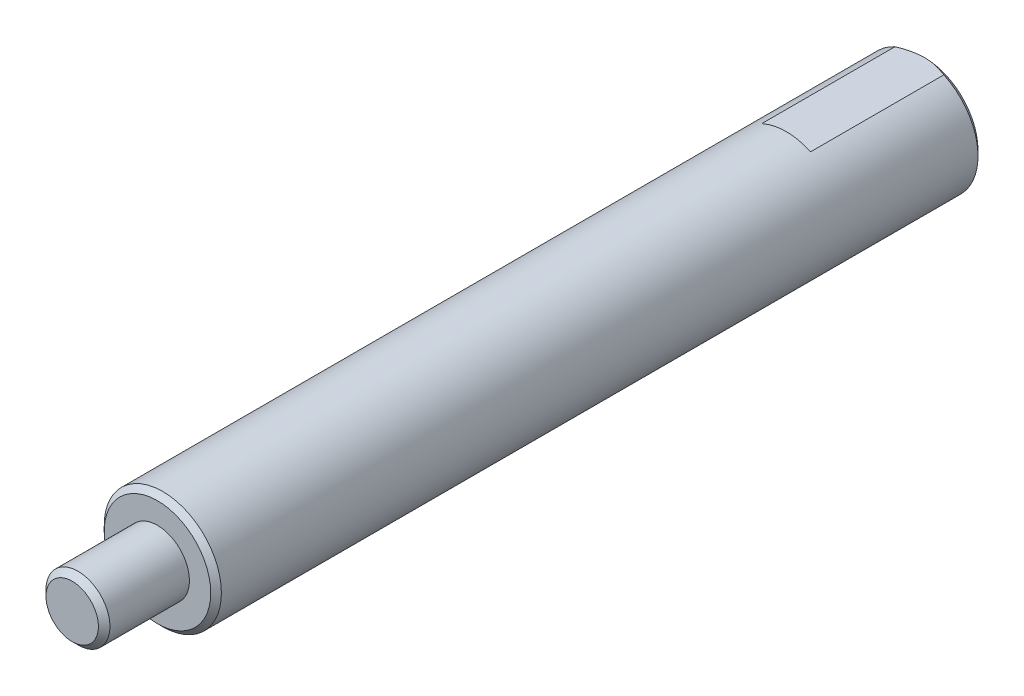
from build123d import *

# Parameters (mm, degrees)
SKETCH_1_R             = 5.5
EXTRUDE_1_DEPTH        = 72
CHAMFER_1_SIZE         = 0.5
SKETCH_2_R             = 3.3
EXTRUDE_2_DEPTH        = 8
HOLE_WIZARD_M5_1_D     = 4.2
HOLE_WIZARD_M5_1_DEPTH = 12.4
HOLE_WIZARD_M5_1_TIP   = 1.2618073
CHAMFER_3_SIZE         = 0.5
SKETCH_6_W             = 10
SKETCH_6_H             = 3
CUT_EXTRUDE_1_DEPTH    = 13


# Read off the part's stored shape, not the designer's step: M6 机械螺纹 螺柱1
with BuildPart() as part:
    # 草图1 → 拉伸1 (new body)
    with BuildSketch(Plane.XY):
        Circle(SKETCH_1_R)
    extrude(amount=EXTRUDE_1_DEPTH)

    # 倒角1
    chamfer_1_edges = [part.edges().sort_by_distance(p)[0] for p in [
        (-5.5, 0, 0),
        (-5.5, 0, 72),
    ]]
    chamfer(chamfer_1_edges, length=CHAMFER_1_SIZE)

    # 草图2 → 拉伸2 (add)
    with BuildSketch(Plane.XY.offset(72)):
        Circle(SKETCH_2_R)
    extrude(amount=EXTRUDE_2_DEPTH)

    # M5 螺纹孔1
    with Locations(Plane(origin=(0, 0, 0), x_dir=(-1, 0, 0), z_dir=(0, 0, -1))):
        with Locations((0, 0)):
            Hole(HOLE_WIZARD_M5_1_D / 2, depth=HOLE_WIZARD_M5_1_DEPTH)
            with Locations((0, 0, -(HOLE_WIZARD_M5_1_DEPTH + HOLE_WIZARD_M5_1_TIP / 2))):  # 118° drill point
                Cone(0, HOLE_WIZARD_M5_1_D / 2, HOLE_WIZARD_M5_1_TIP, mode=Mode.SUBTRACT)

    # 倒角3
    chamfer_3_edges = [part.edges().sort_by_distance(p)[0] for p in [
        (-2.1, 0, 0),
    ]]
    chamfer(chamfer_3_edges, length=CHAMFER_3_SIZE)

    # 草图6 → 切除-拉伸1 (cut)
    with BuildSketch(Plane(origin=(0, 0, 0), x_dir=(-1, 0, 0), z_dir=(0, 0, -1))):
        with Locations((0, 6.5)):
            Rectangle(SKETCH_6_W, SKETCH_6_H)
        with Locations((0, -6.5)):
            Rectangle(SKETCH_6_W, SKETCH_6_H)
    extrude(amount=-CUT_EXTRUDE_1_DEPTH, mode=Mode.SUBTRACT)

    # M6 机械螺纹 螺柱1 outline → M6 机械螺纹 螺柱1 (revolve, cut)
    with BuildSketch(Plane.XZ):
        Polygon((3.3, 80), (2.4585, 80), (3, 79.4585), (3, 72), (3.3, 72), align=None)
    revolve(axis=Axis((0, 0, 0), (0, 0, 1)), mode=Mode.SUBTRACT)


solid = part.part
